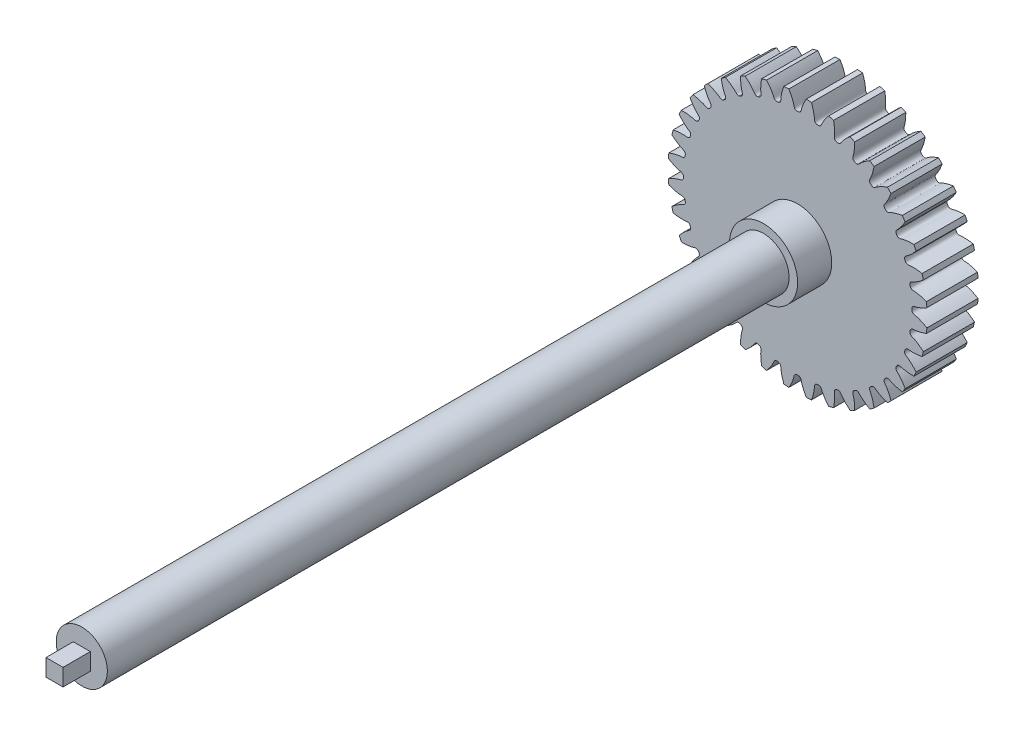
from build123d import *

# Parameters (mm, degrees)
SKETCH_308_W               = 15
SKETCH_308_H               = 37.999999429
CUT_EXTRUDE_501_DEPTH      = 7.5
PATTERN_CIRCULAR_551_COUNT = 36
SKETCH5_R                  = 10
EXTRUDE2_DEPTH             = 10
SKETCH6_R                  = 7.5
EXTRUDE3_DEPTH             = 200
SKETCH7_W                  = 5
SKETCH7_H                  = 5
EXTRUDE4_DEPTH             = 8


with BuildPart() as part:
    # Sketch 308 → Revolve 371 (revolve)
    with BuildSketch(Plane(origin=(0, 0, 0), x_dir=(0, 0, -1), z_dir=(1, 0, 0))):
        with Locations((0, 18.999999714)):
            Rectangle(SKETCH_308_W, SKETCH_308_H)
    revolve(axis=Axis((0, 0, 0), (0, 0, -1)))

    # Sketch 412 → Cut-Extrude 501 (cut, symmetric)
    with BuildSketch(Plane.XY):
        with BuildLine():
            ThreePointArc((38.009834509, 2.619625355), (38.099999428, 0), (38.009834509, -2.619625355))
            add(Edge.make_bspline(
                [(38.009834509, -2.619625355), (37.813774889, -2.5002728), (37.522284048, -2.330555137), (37.135098232, -2.12106692), (36.860427097, -1.979635077), (36.595631751, -1.850065164), (36.341077136, -1.731891674), (36.097113256, -1.624639008), (35.86407482, -1.527822446), (35.642281352, -1.440947286), (35.432035793, -1.363513536), (35.23362826, -1.295001862), (35.047322414, -1.234923033), (34.87340035, -1.182653807), (34.712012238, -1.137985567), (34.498104784, -1.082223169), (34.315557709, -1.047510692), (34.168027901, -1.002139811), (34.111269076, -0.982449348), (34.055478158, -0.960609225), (34.000382048, -0.936246478), (33.945674751, -0.908841034), (33.89103964, -0.877683232), (33.836189957, -0.841809945), (33.780954122, -0.799936463), (33.725433326, -0.750402955), (33.670264552, -0.691190677), (33.616999745, -0.620119084), (33.568499338, -0.535368577), (33.529096834, -0.436471771), (33.505077765, -0.330702778), (33.495449484, -0.18361633), (33.503118339, 0), (33.495449484, 0.18361633), (33.505077765, 0.330702778), (33.529096834, 0.436471771), (33.568499338, 0.535368577), (33.616999745, 0.620119084), (33.670264552, 0.691190677), (33.725433326, 0.750402955), (33.780954122, 0.799936463), (33.836189957, 0.841809945), (33.89103964, 0.877683232), (33.945674751, 0.908841034), (34.000382048, 0.936246478), (34.055478158, 0.960609225), (34.111269076, 0.982449348), (34.168027901, 1.002139811), (34.315557709, 1.047510692), (34.498104784, 1.082223169), (34.712012238, 1.137985567), (34.87340035, 1.182653807), (35.047322414, 1.234923033), (35.23362826, 1.295001862), (35.432035793, 1.363513536), (35.642281352, 1.440947286), (35.86407482, 1.527822446), (36.097113256, 1.624639008), (36.341077136, 1.731891674), (36.595631751, 1.850065164), (36.860427097, 1.979635077), (37.135098232, 2.12106692), (37.522284048, 2.330555137), (37.813774889, 2.5002728), (38.009834509, 2.619625355)],
                knots=[0, 0, 0, 0, 0.062457111, 0.091760772, 0.11978117, 0.146518305, 0.171972177, 0.196142787, 0.219030134, 0.240634218, 0.260955039, 0.279992597, 0.297746893, 0.314217925, 0.329405695, 0.343310202, 0.374368983, 0.379859239, 0.385295478, 0.390713489, 0.396157511, 0.401682397, 0.407356152, 0.413262644, 0.419503807, 0.426199859, 0.433484463, 0.441489759, 0.450315042, 0.459977093, 0.470355566, 0.479679992, 0.5, 0.520320008, 0.529644434, 0.540022907, 0.549684958, 0.558510241, 0.566515537, 0.573800141, 0.580496193, 0.586737356, 0.592643848, 0.598317603, 0.603842489, 0.609286511, 0.614704522, 0.620140761, 0.625631017, 0.656689798, 0.670594305, 0.685782075, 0.702253107, 0.720007403, 0.739044961, 0.759365782, 0.780969866, 0.803857213, 0.828027823, 0.853481695, 0.88021883, 0.908239228, 0.937542889, 1, 1, 1, 1], degree=3))
        make_face()
    cut_extrude_501 = extrude(amount=CUT_EXTRUDE_501_DEPTH, both=True, mode=Mode.SUBTRACT)

    # Pattern Circular 551: Cut-Extrude 501 ×36 about axis
    pattern_circular_551_axis = Axis((0, 0, 55), (0, 0, -1))
    for i in range(1, PATTERN_CIRCULAR_551_COUNT):
        add(cut_extrude_501.rotate(pattern_circular_551_axis, i * 360 / PATTERN_CIRCULAR_551_COUNT), mode=Mode.SUBTRACT)

    # Sketch5 → Extrude2 (add)
    with BuildSketch(Plane.XY.offset(7.5)):
        Circle(SKETCH5_R)
    extrude(amount=EXTRUDE2_DEPTH)

    # Sketch6 → Extrude3 (add)
    with BuildSketch(Plane.XY.offset(17.5)):
        Circle(SKETCH6_R)
    extrude(amount=EXTRUDE3_DEPTH)

    # Sketch7 → Extrude4 (add)
    with BuildSketch(Plane.XY.offset(217.5)):
        Rectangle(SKETCH7_W, SKETCH7_H)
    extrude(amount=EXTRUDE4_DEPTH)


solid = part.part
